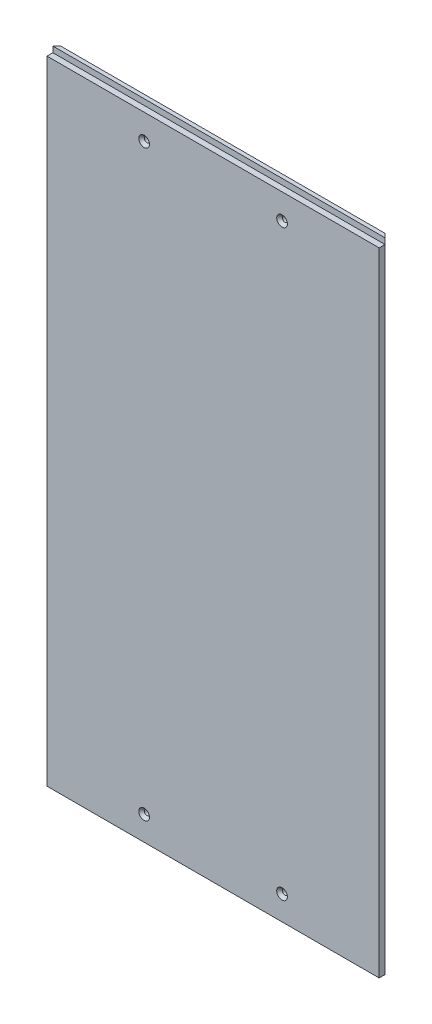
from build123d import *

# Parameters (mm, degrees)
SKETCH1_W           = 342
SKETCH1_H           = 657
BOSS_EXTRUDE1_DEPTH = 12
SKETCH2_W           = 6
SKETCH2_H           = 6
CUT_EXTRUDE1_DEPTH  = 475.362993919
CHAMFER1_SIZE       = 6
SKETCH3_R           = 2.6
CUT_EXTRUDE2_DEPTH  = 371.536435455
CHAMFER2_SIZE       = 2.9
SKETCH4_R           = 6
CUT_EXTRUDE3_DEPTH  = 6
SKETCH5_W           = 342
SKETCH5_H           = 48
CUT_EXTRUDE4_DEPTH  = 2


with BuildPart() as part:
    # Sketch1 → Boss-Extrude1 (new body)
    with BuildSketch(Plane.XY):
        Rectangle(SKETCH1_W, SKETCH1_H)
    extrude(amount=BOSS_EXTRUDE1_DEPTH)

    # Sketch2 → Cut-Extrude1 (cut, through all)
    with BuildSketch(Plane.ZY.offset(171)):
        with Locations((9, 325.5)):
            Rectangle(SKETCH2_W, SKETCH2_H)
    extrude(amount=-CUT_EXTRUDE1_DEPTH, mode=Mode.SUBTRACT)

    # Chamfer1
    chamfer1_edges = [part.edges().sort_by_distance(p)[0] for p in [
        (171, 0, 0),
        (-171, 0, 0),
    ]]
    chamfer(chamfer1_edges, length=CHAMFER1_SIZE - 0.0001)  # a hair under: the kernel refuses the full size

    # Sketch3 → Cut-Extrude2 (cut, through all)
    with BuildSketch(Plane(origin=(0, 0, 0), x_dir=(-1, 0, 0), z_dir=(0, 0, -1))):
        with Locations((-71, -303.5)):
            Circle(SKETCH3_R)
        with Locations((71, -303.5)):
            Circle(SKETCH3_R)
        with Locations((71, 296.5)):
            Circle(SKETCH3_R)
        with Locations((-71, 296.5)):
            Circle(SKETCH3_R)
    extrude(amount=-CUT_EXTRUDE2_DEPTH, mode=Mode.SUBTRACT)

    # Chamfer2
    chamfer2_edges = [part.edges().sort_by_distance(p)[0] for p in [
        (73.6, -303.5, 12),
        (-68.4, -303.5, 12),
        (-68.4, 296.5, 12),
        (73.6, 296.5, 12),
    ]]
    chamfer(chamfer2_edges, length=CHAMFER2_SIZE)

    # Sketch4 → Cut-Extrude3 (cut)
    with BuildSketch(Plane(origin=(0, 0, 0), x_dir=(-1, 0, 0), z_dir=(0, 0, -1))):
        with Locations((-91, 296.5)):
            Circle(SKETCH4_R)
        with Locations((-51, 296.5)):
            Circle(SKETCH4_R)
        with Locations((51, 296.5)):
            Circle(SKETCH4_R)
        with Locations((91, 296.5)):
            Circle(SKETCH4_R)
    extrude(amount=-CUT_EXTRUDE3_DEPTH, mode=Mode.SUBTRACT)

    # Sketch5 → Cut-Extrude4 (cut)
    with BuildSketch(Plane(origin=(0, 0, 0), x_dir=(-1, 0, 0), z_dir=(0, 0, -1))):
        with Locations((0, 304.5)):
            Rectangle(SKETCH5_W, SKETCH5_H)
    extrude(amount=-CUT_EXTRUDE4_DEPTH, mode=Mode.SUBTRACT)


solid = part.part
